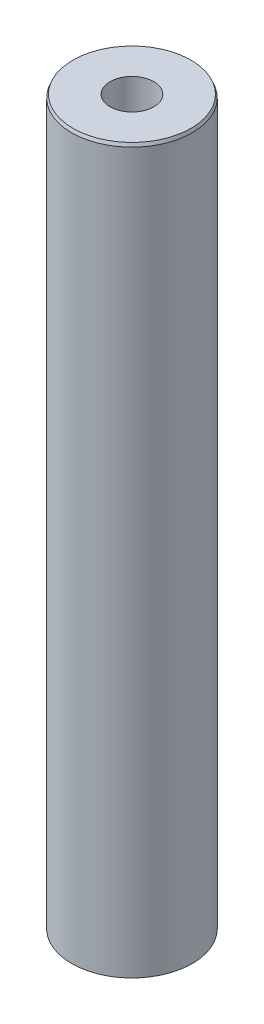
from build123d import *
from OCP.BRepFilletAPI import BRepFilletAPI_MakeChamfer

# Parameters (mm, degrees)
SKETCH1_R           = 50
BOSS_EXTRUDE1_DEPTH = 600
SKETCH2_R           = 18.093483364
CUT_EXTRUDE1_DEPTH  = 605.15229868
CHAMFER1_SIZE       = 2.654420031
CHAMFER1_SIZE2      = 1.052467165


with BuildPart() as part:
    # Sketch1 → Boss-Extrude1 (new body)
    with BuildSketch(Plane(origin=(0, 0, 0), x_dir=(1, 0, 0), z_dir=(0, 1, 0))):
        Circle(SKETCH1_R)
    extrude(amount=BOSS_EXTRUDE1_DEPTH)

    # Sketch2 → Cut-Extrude1 (cut, through all)
    with BuildSketch(Plane(origin=(0, 0, 0), x_dir=(1, 0, 0), z_dir=(0, 1, 0))):
        Circle(SKETCH2_R)
    extrude(amount=CUT_EXTRUDE1_DEPTH, mode=Mode.SUBTRACT)

    # Chamfer1: one chamfer whose edges measure the first distance from different faces: ONE call of the kernel's chamfer builder (chamfer() names one face for all edges)
    chamfer1_edges_1 = [part.edges().sort_by_distance(p)[0] for p in [
        (-50, 600, 0),
    ]]
    chamfer1_side_1 = [part.faces().sort_by_distance(p)[0] for p in [
        (-50, 300, 0),
    ]]
    chamfer1_edges_2 = [part.edges().sort_by_distance(p)[0] for p in [
        (-50, 0, 0),
    ]]
    chamfer1_side_2 = [part.faces().sort_by_distance(p)[0] for p in [
        (-48.585786438, 0, 0),
    ]]
    chamfer1 = BRepFilletAPI_MakeChamfer(part.part.solid().wrapped)
    for e in chamfer1_edges_1:
        chamfer1.Add(CHAMFER1_SIZE, CHAMFER1_SIZE2, e.wrapped, chamfer1_side_1[0].wrapped)  # the first distance lies on this face
    for e in chamfer1_edges_2:
        chamfer1.Add(CHAMFER1_SIZE, CHAMFER1_SIZE2, e.wrapped, chamfer1_side_2[0].wrapped)  # the first distance lies on this face
    add(Compound.cast(chamfer1.Shape()), mode=Mode.REPLACE)


solid = part.part
